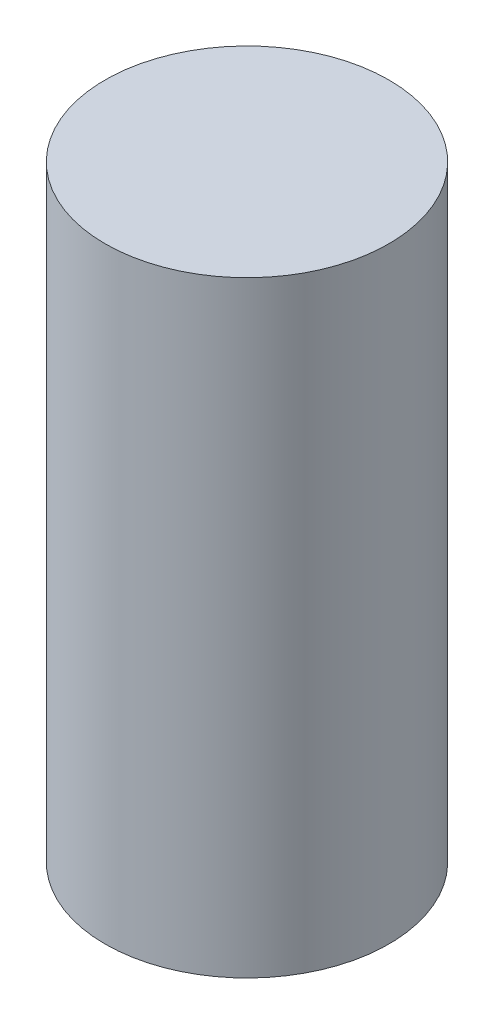
from build123d import *

# Parameters (mm, degrees)
SKETCH1_R           = 3
BOSS_EXTRUDE1_DEPTH = 12.821


with BuildPart() as part:
    # Sketch1 → Boss-Extrude1 (new body)
    with BuildSketch(Plane(origin=(0, 0, 0), x_dir=(1, 0, 0), z_dir=(0, 1, 0))):
        Circle(SKETCH1_R)
    extrude(amount=BOSS_EXTRUDE1_DEPTH)


solid = part.part
